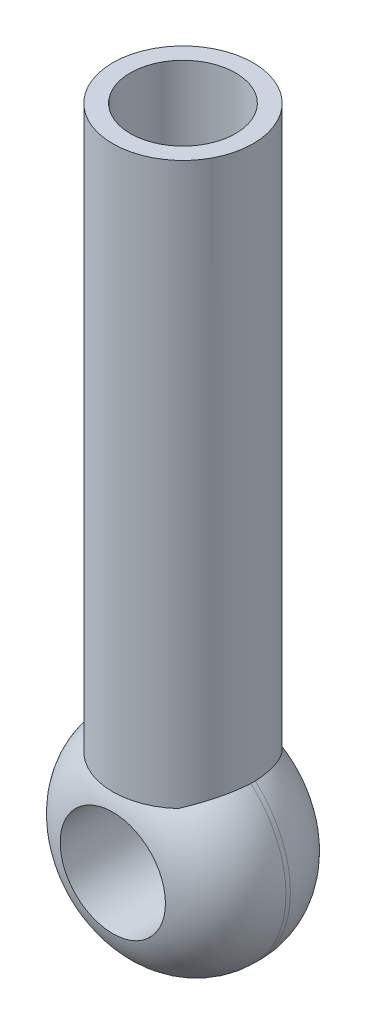
from build123d import *

# Parameters (mm, degrees)
SKETCH1_R           = 15
SKETCH1_R_2         = 7.5
BOSS_EXTRUDE1_DEPTH = 20
FILLET1_R           = 10
BOSS_EXTRUDE2_START = 10
SKETCH2_R           = 10
BOSS_EXTRUDE2_DEPTH = 80
SKETCH3_R           = 7.5
CUT_EXTRUDE1_DEPTH  = 40


with BuildPart() as part:
    # Sketch1 → Boss-Extrude1 (new body)
    with BuildSketch(Plane.XY):
        Circle(SKETCH1_R)
        Circle(SKETCH1_R_2, mode=Mode.SUBTRACT)
    extrude(amount=BOSS_EXTRUDE1_DEPTH)

    # Fillet1
    # the kernel refuses this fillet: 10 mm, written as the material it takes off along each edge
    with BuildSketch(Plane(origin=(0, 0, 0), x_dir=(1, 0, 0), z_dir=(0, -1, 0))) as fillet1_piece_1:
        with BuildLine():
            CenterArc((5, 9.682458366), FILLET1_R, 284.477512186, 75.522487814)
            Line((7.5, 0), (7.55, -0.193649167))
            ThreePointArc((7.55, -0.193649167), (11.25, -0.2), (15, -0.2))
            Line((15, -0.2), (15.2, 0))
            Line((15.2, 0), (15.2, 9.682458366))
            Line((15.2, 9.682458366), (15, 9.682458366))
        make_face()
    revolve(axis=Axis((0, 0, 0), (0, 0, 1)), mode=Mode.SUBTRACT)
    with BuildSketch(Plane(origin=(0, 0, 20), x_dir=(1, 0, 0), z_dir=(0, -1, 0))) as fillet1_piece_2:
        with BuildLine():
            CenterArc((5, -9.682458366), FILLET1_R, 0, 75.522487814)
            Line((7.5, 0), (7.55, 0.193649167))
            ThreePointArc((7.55, 0.193649167), (11.25, 0.2), (15, 0.2))
            Line((15, 0.2), (15.2, 0))
            Line((15.2, 0), (15.2, -9.682458366))
            Line((15.2, -9.682458366), (15, -9.682458366))
        make_face()
    revolve(axis=Axis((0, 0, 20), (0, 0, 1)), mode=Mode.SUBTRACT)

    # Sketch2 → Boss-Extrude2 (add)
    with BuildSketch(Plane(origin=(0, 0, 0), x_dir=(1, 0, 0), z_dir=(0, 1, 0)).offset(BOSS_EXTRUDE2_START)):
        with Locations(Location((0, -10, 0), (0, 0, 47.908263914))):
            Circle(SKETCH2_R)
    extrude(amount=BOSS_EXTRUDE2_DEPTH)

    # Sketch3 → Cut-Extrude1 (cut)
    with BuildSketch(Plane(origin=(0, 90, 0), x_dir=(1, 0, 0), z_dir=(0, 1, 0))):
        with Locations(Location((0, -10, 0), (0, 0, 270))):
            Circle(SKETCH3_R)
    extrude(amount=-CUT_EXTRUDE1_DEPTH, mode=Mode.SUBTRACT)


solid = part.part
